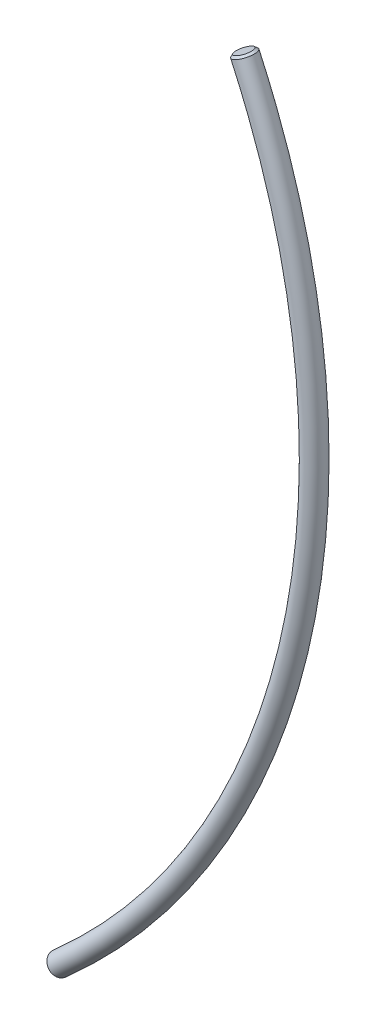
from build123d import *

# Parameters (mm, degrees)
VARREDURA1_PROFILE_R = 2.5
CHANFRO1_SIZE        = 0.5


with BuildPart() as part:
    # Varredura1: sweep along a path in Esboço1
    with BuildLine(Plane.XY) as varredura1_path:
        ThreePointArc((114.665939123, -117.006313722), (171.704371086, -19.358729661), (158.844821082, 92.993686278))
    # Varredura1 profile (on start of the path) → Varredura1 (sweep)
    with BuildSketch(Plane(origin=(114.665939123, -117.006313722, 0), x_dir=(-0.6599993200710162, 0.7512661961687057, 0), z_dir=(0.7512661961687057, 0.6599993200710162, 0))):
        Circle(VARREDURA1_PROFILE_R)
    sweep(path=varredura1_path.line)

    # Chanfro1
    chanfro1_edges = [part.edges().sort_by_distance(p)[0] for p in [
        (161.111706792, 94.047834833, 0),
        (116.315937423, -118.884479213, 0),
    ]]
    chamfer(chanfro1_edges, length=CHANFRO1_SIZE)


solid = part.part
